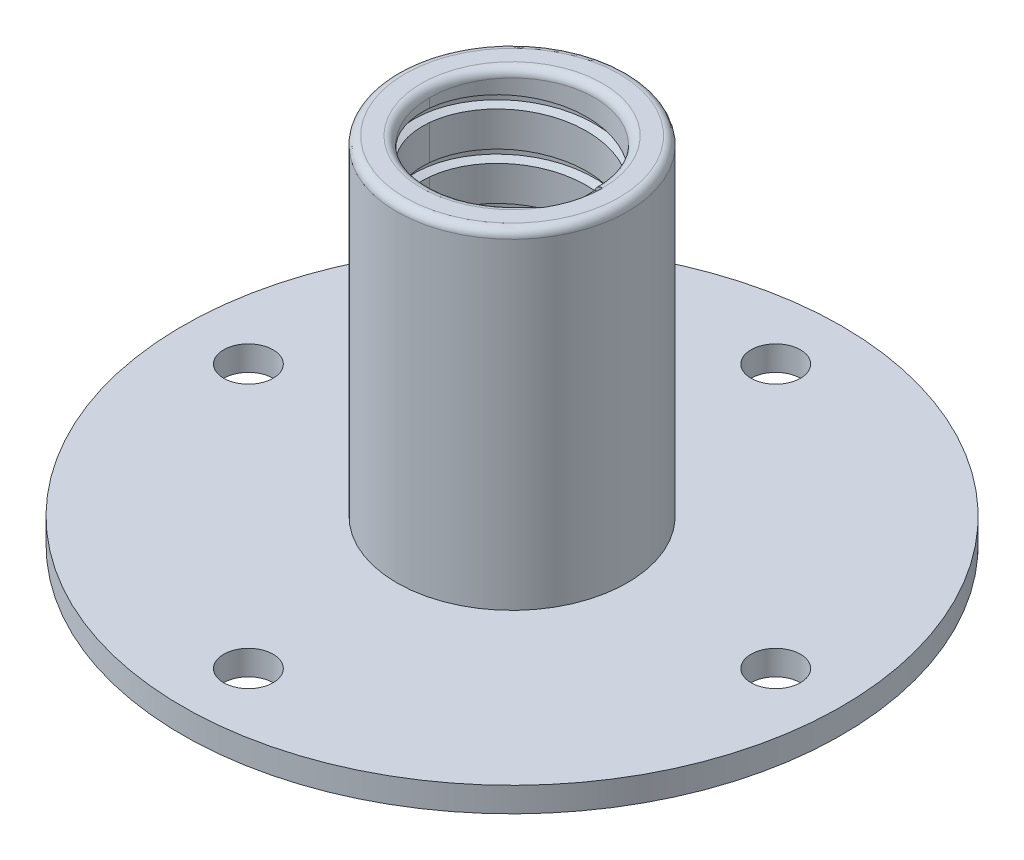
from build123d import *

# Parameters (mm, degrees)
SKETCH1_R           = 101.6
SKETCH1_R_2         = 25.4
BOSS_EXTRUDE1_DEPTH = 7.62
SKETCH6_R           = 7.62
CUT_EXTRUDE2_DEPTH  = 101.6
SKETCH2_R           = 35.56
BOSS_EXTRUDE2_DEPTH = 101.6
CUT_EXTRUDE1_START  = -101.6
SKETCH3_R           = 25.4
CUT_EXTRUDE1_DEPTH  = 101.6
FILLET1_R           = 2.54
CUT_SWEEP1_PITCH    = 14.514285714
FILLET2_R           = 2.54


with BuildPart() as part:
    # Sketch1 → Boss-Extrude1 (new body)
    with BuildSketch(Plane(origin=(0, 0, 0), x_dir=(1, 0, 0), z_dir=(0, 1, 0))):
        with Locations(Location((0, 0, 0), (0, 0, 90))):
            Circle(SKETCH1_R)
        with Locations(Location((0, 0, 0), (0, 0, 90))):
            Circle(SKETCH1_R_2, mode=Mode.SUBTRACT)
    extrude(amount=BOSS_EXTRUDE1_DEPTH)

    # Sketch6 → Cut-Extrude2 (cut)
    with BuildSketch(Plane(origin=(0, 7.62, 0), x_dir=(1, 0, 0), z_dir=(0, 1, 0))):
        with Locations(Location((0, -81.28, 0), (0, 0, 270))):
            Circle(SKETCH6_R)
        with Locations(Location((-81.28, 0, 0), (0, 0, 270))):
            Circle(SKETCH6_R)
        with Locations(Location((0, 81.28, 0), (0, 0, 270))):
            Circle(SKETCH6_R)
        with Locations(Location((81.28, 0, 0), (0, 0, 270))):
            Circle(SKETCH6_R)
    extrude(amount=-CUT_EXTRUDE2_DEPTH, mode=Mode.SUBTRACT)

    # Sketch2 → Boss-Extrude2 (add)
    with BuildSketch(Plane(origin=(0, 7.62, 0), x_dir=(1, 0, 0), z_dir=(0, 1, 0))):
        with Locations(Location((0, 0, 0), (0, 0, 270))):
            Circle(SKETCH2_R)
    extrude(amount=BOSS_EXTRUDE2_DEPTH)

    # Sketch3 → Cut-Extrude1 (cut)
    with BuildSketch(Plane(origin=(0, 109.22, 0), x_dir=(1, 0, 0), z_dir=(0, 1, 0)).offset(CUT_EXTRUDE1_START)):
        with Locations(Location((0, 0, 0), (0, 0, 90))):
            Circle(SKETCH3_R)
    extrude(amount=CUT_EXTRUDE1_DEPTH, mode=Mode.SUBTRACT)

    # Fillet1
    fillet1_edges = [part.edges().sort_by_distance(p)[0] for p in [
        (0, 109.22, 25.4),
    ]]
    fillet(fillet1_edges, radius=FILLET1_R)

    # Cut-Sweep1: the profile of Sketch5 profile screwed along a right-hand helix of 3.5 turns, 18 arcs to a turn; built about Z, then put on its axis
    cut_sweep1_z = Axis((0, 0, 0), (0, 0, 1))
    cut_sweep1_corners = [(25.3997, 0, 1.905080385), (25.3997, 0, -1.905080385), (27.94, 0, -1.224409051), (27.94, 0, 1.224409051)]
    with BuildLine(mode=Mode.PRIVATE) as cut_sweep1_profile:
        Line(cut_sweep1_corners[0], cut_sweep1_corners[1])
        Line(cut_sweep1_corners[1], cut_sweep1_corners[2])
        Line(cut_sweep1_corners[2], cut_sweep1_corners[3])
        Line(cut_sweep1_corners[3], cut_sweep1_corners[0])
    cut_sweep1_cap = Face(cut_sweep1_profile.wire())
    cut_sweep1_turn_angles = [0, 10, 20, 30, 40, 50, 60, 70, 80, 90, 100, 110, 120, 130, 140, 150, 160, 170, 180, 190, 200, 210, 220, 230, 240, 250, 260, 270, 280, 290, 300, 310, 320, 330, 340, 350, 360]
    cut_sweep1_turn_weights = [1, 0.984807753012208, 1, 0.984807753012208, 1, 0.984807753012208, 1, 0.984807753012208, 1, 0.984807753012208, 1, 0.984807753012208, 1, 0.984807753012208, 1, 0.984807753012208, 1, 0.984807753012208, 1, 0.984807753012208, 1, 0.984807753012208, 1, 0.984807753012208, 1, 0.984807753012208, 1, 0.984807753012208, 1, 0.984807753012208, 1, 0.984807753012208, 1, 0.984807753012208, 1, 0.984807753012208, 1]
    cut_sweep1_turn_rails = [Edge.make_bspline([Vector(p[0], p[1], 0).rotate(cut_sweep1_z, cut_sweep1_turn_angles[k]) / cut_sweep1_turn_weights[k] + Vector(0, 0, p[2] + CUT_SWEEP1_PITCH * cut_sweep1_turn_angles[k] / 360) for k in range(37)], [0, 0, 0, 1, 1, 2, 2, 3, 3, 4, 4, 5, 5, 6, 6, 7, 7, 8, 8, 9, 9, 10, 10, 11, 11, 12, 12, 13, 13, 14, 14, 15, 15, 16, 16, 17, 17, 18, 18, 18], 2, cut_sweep1_turn_weights) for p in cut_sweep1_corners]
    cut_sweep1_turn_sides = [Face.make_surface_from_curves(cut_sweep1_turn_rails[p[0]], cut_sweep1_turn_rails[p[1]]) for p in [(0, 1), (1, 2), (2, 3), (3, 0)]]
    cut_sweep1_last_angles = [1080, 1090, 1100, 1110, 1120, 1130, 1140, 1150, 1160, 1170, 1180, 1190, 1200, 1210, 1220, 1230, 1240, 1250, 1260]
    cut_sweep1_last_weights = [1, 0.984807753012208, 1, 0.984807753012208, 1, 0.984807753012208, 1, 0.984807753012208, 1, 0.984807753012208, 1, 0.984807753012208, 1, 0.984807753012208, 1, 0.984807753012208, 1, 0.984807753012207, 1]
    cut_sweep1_last_rails = [Edge.make_bspline([Vector(p[0], p[1], 0).rotate(cut_sweep1_z, cut_sweep1_last_angles[k]) / cut_sweep1_last_weights[k] + Vector(0, 0, p[2] + CUT_SWEEP1_PITCH * cut_sweep1_last_angles[k] / 360) for k in range(19)], [0, 0, 0, 1, 1, 2, 2, 3, 3, 4, 4, 5, 5, 6, 6, 7, 7, 8, 8, 9, 9, 9], 2, cut_sweep1_last_weights) for p in cut_sweep1_corners]
    cut_sweep1_last_sides = [Face.make_surface_from_curves(cut_sweep1_last_rails[p[0]], cut_sweep1_last_rails[p[1]]) for p in [(0, 1), (1, 2), (2, 3), (3, 0)]]
    cut_sweep1 = Plane(origin=(0, 109.22, 0), x_dir=(1, 0, 0), z_dir=(0, -1, 0)) * Solid(Shell([*[p.moved(Location((0, 0, CUT_SWEEP1_PITCH * i))) for i in range(3) for p in cut_sweep1_turn_sides], *cut_sweep1_last_sides, cut_sweep1_cap, cut_sweep1_cap.rotate(cut_sweep1_z, 1260).moved(Location((0, 0, CUT_SWEEP1_PITCH * 1260 / 360)))]))
    add(cut_sweep1, mode=Mode.SUBTRACT)

    # Fillet2
    fillet2_edges = [part.edges().sort_by_distance(p)[0] for p in [
        (0, 109.22, -35.56),
    ]]
    fillet(fillet2_edges, radius=FILLET2_R)


solid = part.part
